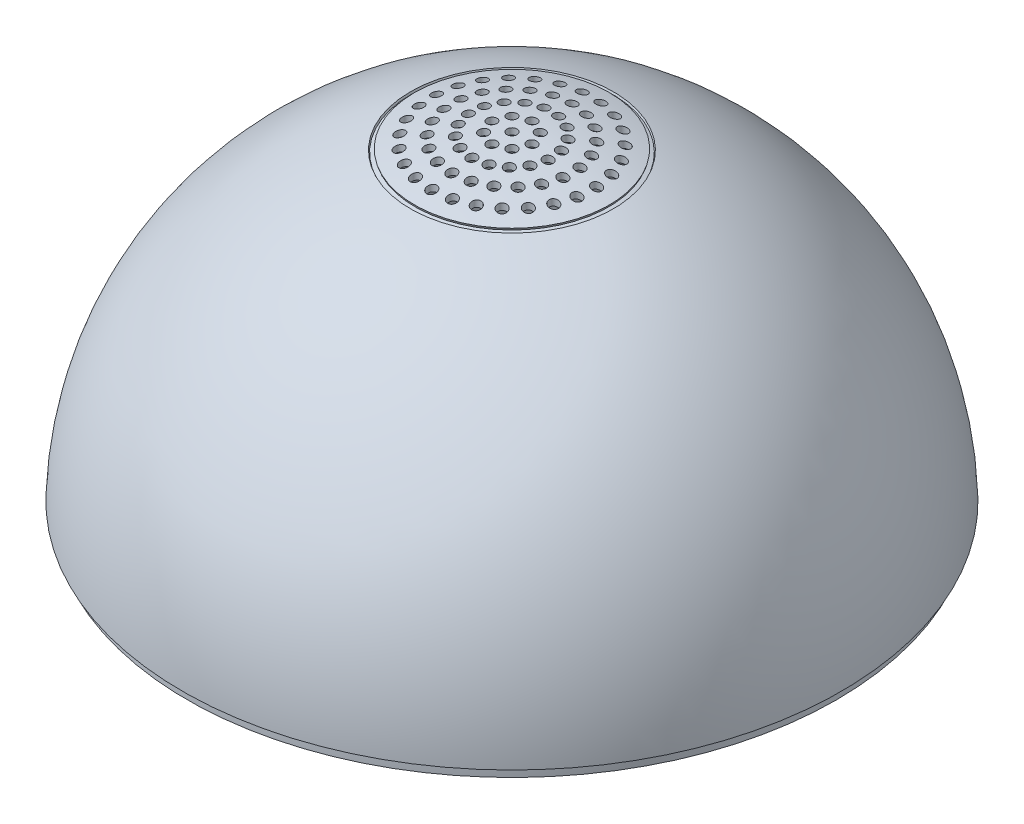
from build123d import *

# Parameters (mm, degrees)
SKETCH7_R                            = 2
BOSS_EXTRUDE2_DEPTH                  = 10
BOSS_EXTRUDE2_DIRECTION_2_REACH      = 144.483
BOSS_EXTRUDE2_DIRECTION_2_END_RADIUS = 79.75
CUT_EXTRUDE2_DEPTH                   = 143.483113
CUT_EXTRUDE2_DEPTH_BACK              = 143.483113
SKETCH12_R                           = 1.25
SKETCH12_12_R                        = 1.25
CUT_EXTRUDE3_DEPTH                   = 143.47763
CIRPATTERN1_COUNT                    = 8
SKETCH12_13_R                        = 1.25
CUT_EXTRUDE4_DEPTH                   = 143.47763
SKETCH12_15_R                        = 1.25
CUT_EXTRUDE6_DEPTH                   = 143.47763
CIRPATTERN2_COUNT                    = 27
CIRPATTERN3_COUNT                    = 17
SKETCH12_16_R                        = 1.25
CUT_EXTRUDE7_DEPTH                   = 143.47763
CIRPATTERN4_COUNT                    = 22
CUT_EXTRUDE8_REACH                   = 150.477
CUT_EXTRUDE8_END_RADIUS              = 79.75
SKETCH13_R                           = 2


with BuildPart() as part:
    # Sketch4 → Revolve1 (revolve)
    with BuildSketch(Plane.XY):
        with BuildLine():
            Line((0, 79.75), (0, 82.287985))
            ThreePointArc((0, 82.287985), (-57.295692, 59.063663), (-82.25, 2.5))
            Line((-82.25, 2.5), (-80.961411, 2.5))
            ThreePointArc((-80.961411, 2.5), (-80.990352, 1.250149), (-81, 0))
            Line((-81, 0), (-79.75, 0))
            ThreePointArc((-79.75, 0), (-56.391766, 56.391766), (0, 79.75))
        make_face()
    revolve(axis=Axis((0, -82.25, 0), (0, 1, 0)))

    # Sketch7 → Boss-Extrude2 (add)
    with BuildSketch(Plane(origin=(0, 0, 0), x_dir=(1, 0, 0), z_dir=(0, 1, 0))):
        with Locations((-77.5, 0)):
            Circle(SKETCH7_R)
        with Locations((77.5, 0)):
            Circle(SKETCH7_R)
    extrude(amount=-BOSS_EXTRUDE2_DEPTH)

    # Boss-Extrude2 direction 2: up to this sphere (the profile starts inside it)
    boss_extrude2_direction_2_end = Location((0, 0, 0)) * Sphere(BOSS_EXTRUDE2_DIRECTION_2_END_RADIUS, mode=Mode.PRIVATE)
    # Sketch7 → Boss-Extrude2 direction 2 (add, up to the surface)
    with BuildSketch(Plane(origin=(0, 0, 0), x_dir=(1, 0, 0), z_dir=(0, 1, 0)), mode=Mode.PRIVATE) as boss_extrude2_direction_2_sk1:
        with Locations((-77.5, 0)):
            Circle(SKETCH7_R)
    boss_extrude2_direction_2_tool1 = extrude(boss_extrude2_direction_2_sk1.sketch, amount=BOSS_EXTRUDE2_DIRECTION_2_REACH, mode=Mode.PRIVATE) & boss_extrude2_direction_2_end
    add(boss_extrude2_direction_2_tool1.solids().sort_by_distance((-77.5, 0, 0))[0])
    # Sketch7 → Boss-Extrude2 direction 2 (add, up to the surface)
    with BuildSketch(Plane(origin=(0, 0, 0), x_dir=(1, 0, 0), z_dir=(0, 1, 0)), mode=Mode.PRIVATE) as boss_extrude2_direction_2_sk2:
        with Locations((77.5, 0)):
            Circle(SKETCH7_R)
    boss_extrude2_direction_2_tool2 = extrude(boss_extrude2_direction_2_sk2.sketch, amount=BOSS_EXTRUDE2_DIRECTION_2_REACH, mode=Mode.PRIVATE) & boss_extrude2_direction_2_end
    add(boss_extrude2_direction_2_tool2.solids().sort_by_distance((77.5, 0, 0))[0])

    # Sketch9 → Cut-Revolve1 (revolve, cut)
    with BuildSketch(Plane.XY):
        with BuildLine():
            Line((-25.617277, 79.023215), (-25.132044, 77.815862))
            ThreePointArc((-25.132044, 77.815862), (-24.644019, 77.971792), (-24.155026, 78.124661))
            Line((-24.155026, 78.124661), (-24.53847, 79.364834))
            ThreePointArc((-24.53847, 79.364834), (-25.078455, 79.195862), (-25.617277, 79.023215))
        make_face()
        with BuildLine():
            Line((-26.295537, 76.31334), (-25.299277, 71.268276))
            ThreePointArc((-25.299277, 71.268276), (-12.835878, 74.528256), (0, 75.625529))
            Line((0, 75.625529), (0, 80.716672))
            ThreePointArc((0, 80.716672), (-13.330834, 79.608228), (-26.295537, 76.31334))
        make_face()
    revolve(axis=Axis((0, 82.413104, 0), (0, -1, 0)), mode=Mode.SUBTRACT)

    # Sketch12 → Cut-Extrude2 (cut, two sides: drawn at the far end of the back side and taken through both)
    with BuildSketch(Plane(origin=(0, 0, 0), x_dir=(1, 0, 0), z_dir=(0, 1, 0)).offset(-CUT_EXTRUDE2_DEPTH_BACK)):
        Circle(SKETCH12_R)
    extrude(amount=CUT_EXTRUDE2_DEPTH + CUT_EXTRUDE2_DEPTH_BACK, mode=Mode.SUBTRACT)

    # Sketch12<12> → Cut-Extrude3 (cut, symmetric)
    with BuildSketch(Plane(origin=(0, 0, 0), x_dir=(1, 0, 0), z_dir=(0, 1, 0))):
        with Locations((0, -5)):
            Circle(SKETCH12_12_R)
    cut_extrude3 = extrude(amount=CUT_EXTRUDE3_DEPTH, both=True, mode=Mode.SUBTRACT)

    # CirPattern1: Cut-Extrude3 ×8 about axis
    cirpattern1_axis = Axis((0, 80.706993, 0), (0, 1, 0))
    for i in range(1, CIRPATTERN1_COUNT):
        add(cut_extrude3.rotate(cirpattern1_axis, i * 360 / CIRPATTERN1_COUNT), mode=Mode.SUBTRACT)

    # Sketch12<13> → Cut-Extrude4 (cut, symmetric)
    with BuildSketch(Plane(origin=(0, 0, 0), x_dir=(1, 0, 0), z_dir=(0, 1, 0))):
        with Locations((0, -10)):
            Circle(SKETCH12_13_R)
    cut_extrude4 = extrude(amount=CUT_EXTRUDE4_DEPTH, both=True, mode=Mode.SUBTRACT)

    # Sketch12<15> → Cut-Extrude6 (cut, symmetric)
    with BuildSketch(Plane(origin=(0, 0, 0), x_dir=(1, 0, 0), z_dir=(0, 1, 0))):
        with Locations((0, -20)):
            Circle(SKETCH12_15_R)
    cut_extrude6 = extrude(amount=CUT_EXTRUDE6_DEPTH, both=True, mode=Mode.SUBTRACT)

    # CirPattern2: Cut-Extrude6 ×27 about axis
    cirpattern2_axis = Axis((0, 80.706993, 0), (0, 1, 0))
    for i in range(1, CIRPATTERN2_COUNT):
        add(cut_extrude6.rotate(cirpattern2_axis, i * 360 / CIRPATTERN2_COUNT), mode=Mode.SUBTRACT)

    # CirPattern3: Cut-Extrude4 ×17 about axis
    cirpattern3_axis = Axis((0, 80.706993, 0), (0, 1, 0))
    for i in range(1, CIRPATTERN3_COUNT):
        add(cut_extrude4.rotate(cirpattern3_axis, i * 360 / CIRPATTERN3_COUNT), mode=Mode.SUBTRACT)

    # Sketch12<16> → Cut-Extrude7 (cut, symmetric)
    with BuildSketch(Plane(origin=(0, 0, 0), x_dir=(1, 0, 0), z_dir=(0, 1, 0))):
        with Locations((0, -15)):
            Circle(SKETCH12_16_R)
    cut_extrude7 = extrude(amount=CUT_EXTRUDE7_DEPTH, both=True, mode=Mode.SUBTRACT)

    # CirPattern4: Cut-Extrude7 ×22 about axis
    cirpattern4_axis = Axis((0, 80.706993, 0), (0, 1, 0))
    for i in range(1, CIRPATTERN4_COUNT):
        add(cut_extrude7.rotate(cirpattern4_axis, i * 360 / CIRPATTERN4_COUNT), mode=Mode.SUBTRACT)

    # Cut-Extrude8: up to this sphere (the profile starts inside it)
    cut_extrude8_end = Location((0, 0, 0)) * Sphere(CUT_EXTRUDE8_END_RADIUS, mode=Mode.PRIVATE)
    # Sketch13 → Cut-Extrude8 (cut, up to the surface)
    with BuildSketch(Plane.XZ.offset(10), mode=Mode.PRIVATE) as cut_extrude8_sk1:
        with Locations((-77.5, 0)):
            Circle(SKETCH13_R)
    cut_extrude8_tool1 = extrude(cut_extrude8_sk1.sketch, amount=-CUT_EXTRUDE8_REACH, mode=Mode.PRIVATE) & cut_extrude8_end
    add(cut_extrude8_tool1.solids().sort_by_distance((-77.5, -10, 0))[0], mode=Mode.SUBTRACT)
    # Sketch13 → Cut-Extrude8 (cut, up to the surface)
    with BuildSketch(Plane.XZ.offset(10), mode=Mode.PRIVATE) as cut_extrude8_sk2:
        with Locations((77.5, 0)):
            Circle(SKETCH13_R)
    cut_extrude8_tool2 = extrude(cut_extrude8_sk2.sketch, amount=-CUT_EXTRUDE8_REACH, mode=Mode.PRIVATE) & cut_extrude8_end
    add(cut_extrude8_tool2.solids().sort_by_distance((77.5, -10, 0))[0], mode=Mode.SUBTRACT)


with BuildPart() as cut_extrude8_kept_piece:
    # of the separate pieces the step leaves, the one the design keeps (cut_extrude8_pieces_kept)
    add(part.part.solids().sort_by_distance((-82.25, 2.5, 0))[0])


solid = cut_extrude8_kept_piece.part
